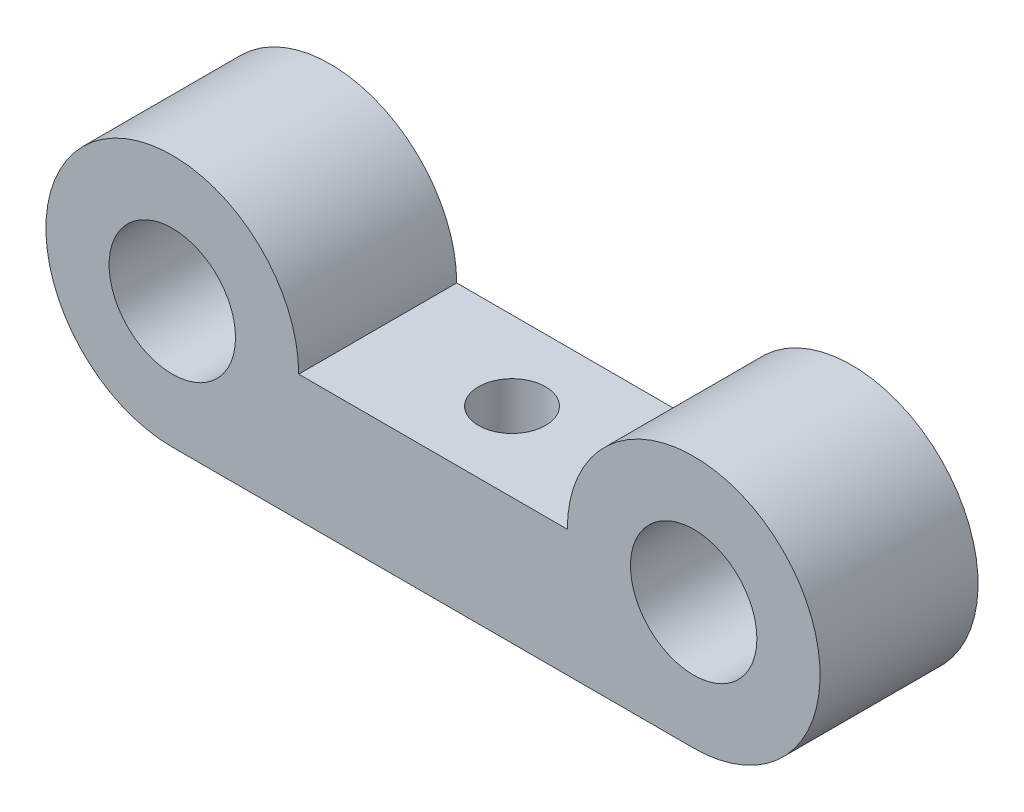
from build123d import *

# Parameters (mm, degrees)
ESBO_O1_R                = 4
RESSALTO_EXTRUS_O1_DEPTH = 10
ESBO_O2_R                = 2.125
CORTE_EXTRUS_O1_DEPTH    = 10


with BuildPart() as part:
    # Esboço1 → Ressalto-extrusão1 (new body)
    with BuildSketch(Plane.XY):
        with BuildLine():
            Line((-16.5, -8), (16.5, -8))
            ThreePointArc((16.5, -8), (22.156854249, 5.656854249), (8.5, 0))
            Line((8.5, 0), (-8.5, 0))
            ThreePointArc((-8.5, 0), (-22.156854249, 5.656854249), (-16.5, -8))
        make_face()
        with Locations((-16.5, 0)):
            Circle(ESBO_O1_R, mode=Mode.SUBTRACT)
        with Locations((16.5, 0)):
            Circle(ESBO_O1_R, mode=Mode.SUBTRACT)
    extrude(amount=RESSALTO_EXTRUS_O1_DEPTH)

    # Esboço2 → Corte-extrusão1 (cut)
    with BuildSketch(Plane(origin=(0, 0, 0), x_dir=(1, 0, 0), z_dir=(0, 1, 0))):
        with Locations((0, -5)):
            Circle(ESBO_O2_R)
    extrude(amount=-CORTE_EXTRUS_O1_DEPTH, mode=Mode.SUBTRACT)


solid = part.part
